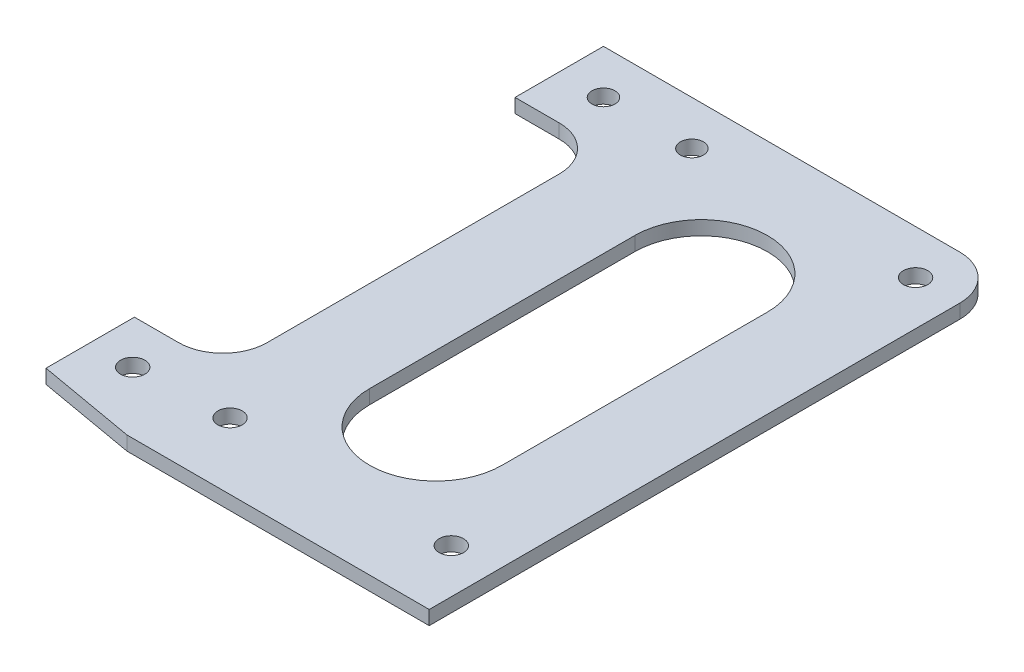
from build123d import *

# Parameters (mm, degrees)
BASE_FLANGE1_DEPTH         = 3.175
CUT_EXTRUDE1_DEPTH         = 194.329458355
CUT_EXTRUDE2_DEPTH         = 194.329458355
F_5_2_5_2_DIAMETER_HOLE1_D = 5.2
F_5_5_5_5_DIAMETER_HOLE1_D = 5.5


# Sheet-metal steps are written as plain solids
with BuildPart() as part:
    # Sketch11 → Base-Flange1 (new body)
    with BuildSketch(Plane.XZ.offset(-32.134736729)):
        with BuildLine():
            Line((-82.671285527, -32.35), (-104.922239506, -36.273443533))
            Line((-104.922239506, -36.273443533), (-104.922239506, -162.35))
            Line((-104.922239506, -162.35), (-24.333100178, -162.35))
            ThreePointArc((-24.333100178, -162.35), (-17.262032366, -159.421067812), (-14.333100178, -152.35))
            Line((-14.333100178, -152.35), (-14.333100178, -32.35))
            Line((-14.333100178, -32.35), (-82.671285527, -32.35))
        make_face()
    extrude(amount=-BASE_FLANGE1_DEPTH)

    # Sketch16 → Cut-Extrude1 (cut, through all)
    with BuildSketch(Plane(origin=(0, 35.309736729, 0), x_dir=(-1, 0, 0), z_dir=(0, 1, 0))):
        with BuildLine():
            Line((104.922239506, -142.35), (104.922239506, -56.273443533))
            Line((104.922239506, -56.273443533), (94.922239506, -56.273443533))
            ThreePointArc((94.922239506, -56.273443533), (87.851171694, -59.202375721), (84.922239506, -66.273443533))
            Line((84.922239506, -66.273443533), (84.922239506, -132.35))
            ThreePointArc((84.922239506, -132.35), (87.851171694, -139.421067812), (94.922239506, -142.35))
            Line((94.922239506, -142.35), (104.922239506, -142.35))
        make_face()
    extrude(amount=-CUT_EXTRUDE1_DEPTH, mode=Mode.SUBTRACT)

    # Sketch17 → Cut-Extrude2 (cut, through all)
    with BuildSketch(Plane(origin=(0, 35.309736729, 0), x_dir=(-1, 0, 0), z_dir=(0, 1, 0))):
        with BuildLine():
            Line((64.333100178, -128.85), (64.333100178, -68.85))
            ThreePointArc((64.333100178, -68.85), (49.333100178, -53.85), (34.333100178, -68.85))
            Line((34.333100178, -68.85), (34.333100178, -128.85))
            ThreePointArc((34.333100178, -128.85), (49.333100178, -143.85), (64.333100178, -128.85))
        make_face()
    extrude(amount=-CUT_EXTRUDE2_DEPTH, mode=Mode.SUBTRACT)

    # Ø5.2 (5.2) Diameter Hole1 (through all)
    with Locations(Plane(origin=(0, 32.134736729, 0), x_dir=(-1, 0, 0), z_dir=(0, -1, 0))):
        with Locations((94.922239506, 152.35), (74.922239506, 152.35)):
            Hole(F_5_2_5_2_DIAMETER_HOLE1_D / 2)

    # Ø5.5 (5.5) Diameter Hole1 (through all)
    with Locations(Plane(origin=(0, 32.134736729, 0), x_dir=(-1, 0, 0), z_dir=(0, -1, 0))):
        with Locations((95.316058397, 46.273443533), (74.375466886, 47.35), (24.333100178, 47.35), (24.333100178, 152.35)):
            Hole(F_5_5_5_5_DIAMETER_HOLE1_D / 2)


solid = part.part
